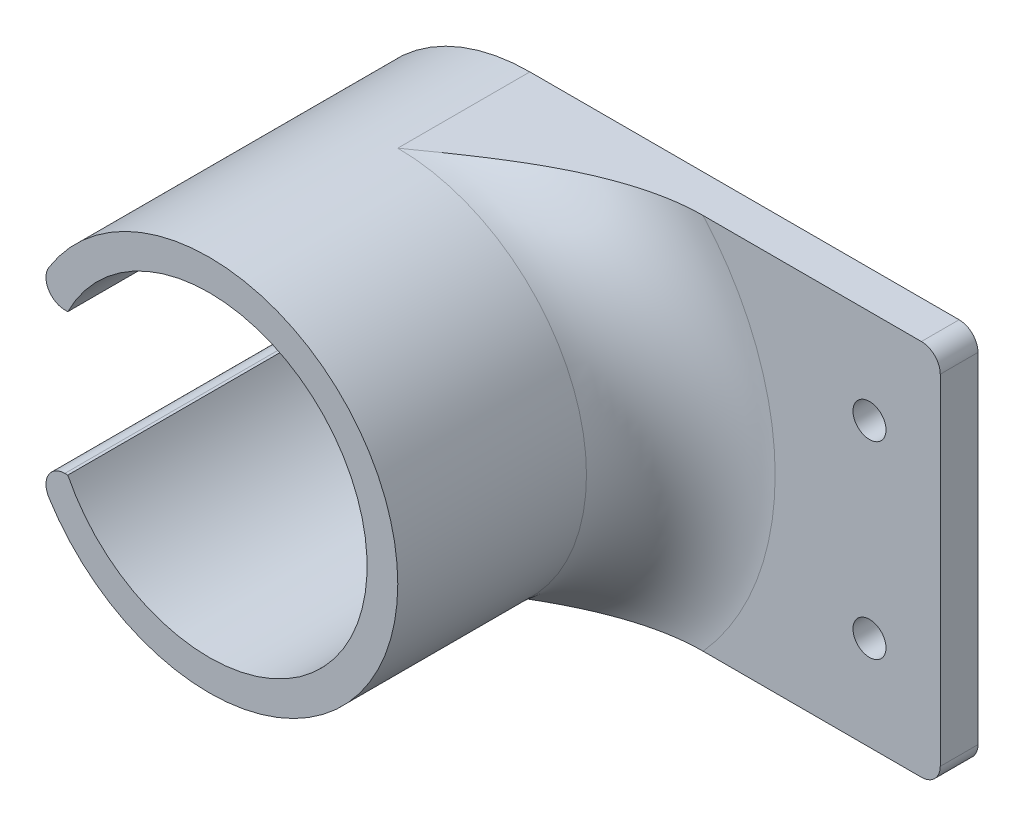
from build123d import *

# Parameters (mm, degrees)
SKETCH_1_R               = 1.75
EXTRUDE_1_DEPTH          = 4
SKETCH_2_R               = 20
SKETCH_2_R_2             = 16.75
EXTRUDE_2_DEPTH          = 30
CUT_EXTRUDE_1_DEPTH      = 62.743420702
CUT_EXTRUDE_1_DEPTH_BACK = 62.743420702
FILLET_1_R               = 10
FILLET_2_R               = 2
FILLET_3_R               = 2
FILLET_4_R               = 2


with BuildPart() as part:
    # 草图1 → 凸台-拉伸1 (new body)
    with BuildSketch(Plane.XY):
        with BuildLine():
            Line((0, 20), (47.5, 20))
            Line((47.5, 20), (47.5, -20))
            Line((47.5, -20), (0, -20))
            ThreePointArc((0, -20), (-20, 0), (0, 20))
        make_face()
        with Locations((40, 10)):
            Circle(SKETCH_1_R, mode=Mode.SUBTRACT)
        with Locations((40, -10)):
            Circle(SKETCH_1_R, mode=Mode.SUBTRACT)
    extrude(amount=EXTRUDE_1_DEPTH)

    # 草图2 → 凸台-拉伸2 (add)
    with BuildSketch(Plane.XY.offset(4)):
        Circle(SKETCH_2_R)
        Circle(SKETCH_2_R_2, mode=Mode.SUBTRACT)
    extrude(amount=EXTRUDE_2_DEPTH)

    # 草图3 → 切除-拉伸1 (cut, two sides: drawn at the far end of the back side and taken through both)
    with BuildSketch(Plane(origin=(0, 0, 0), x_dir=(-1, 0, 0), z_dir=(0, 0, -1)).offset(-CUT_EXTRUDE_1_DEPTH_BACK)):
        with BuildLine():
            Line((-7.5, 7.5), (20, 7.5))
            ThreePointArc((20, 7.5), (27.5, 0), (20, -7.5))
            Line((20, -7.5), (-7.5, -7.5))
            ThreePointArc((-7.5, -7.5), (-15, 0), (-7.5, 7.5))
        make_face()
    extrude(amount=CUT_EXTRUDE_1_DEPTH + CUT_EXTRUDE_1_DEPTH_BACK, mode=Mode.SUBTRACT)

    # 圆角1
    fillet_1_edges = [part.edges().sort_by_distance(p)[0] for p in [
        (14.142135624, -14.142135624, 4),
    ]]
    fillet(fillet_1_edges, radius=FILLET_1_R)

    # 圆角2
    fillet_2_edges = [part.edges().sort_by_distance(p)[0] for p in [
        (3.853352296, -16.300741581, 4),
    ]]
    fillet(fillet_2_edges, radius=FILLET_2_R)

    # 圆角3
    fillet_3_edges = [part.edges().sort_by_distance(p)[0] for p in [
        (-18.540496218, -7.5, 19),
        (-18.540496218, 7.5, 19),
    ]]
    fillet(fillet_3_edges, radius=FILLET_3_R)

    # 圆角4
    fillet_4_edges = [part.edges().sort_by_distance(p)[0] for p in [
        (47.5, 20, 2),
        (47.5, -20, 2),
    ]]
    fillet(fillet_4_edges, radius=FILLET_4_R)


solid = part.part
